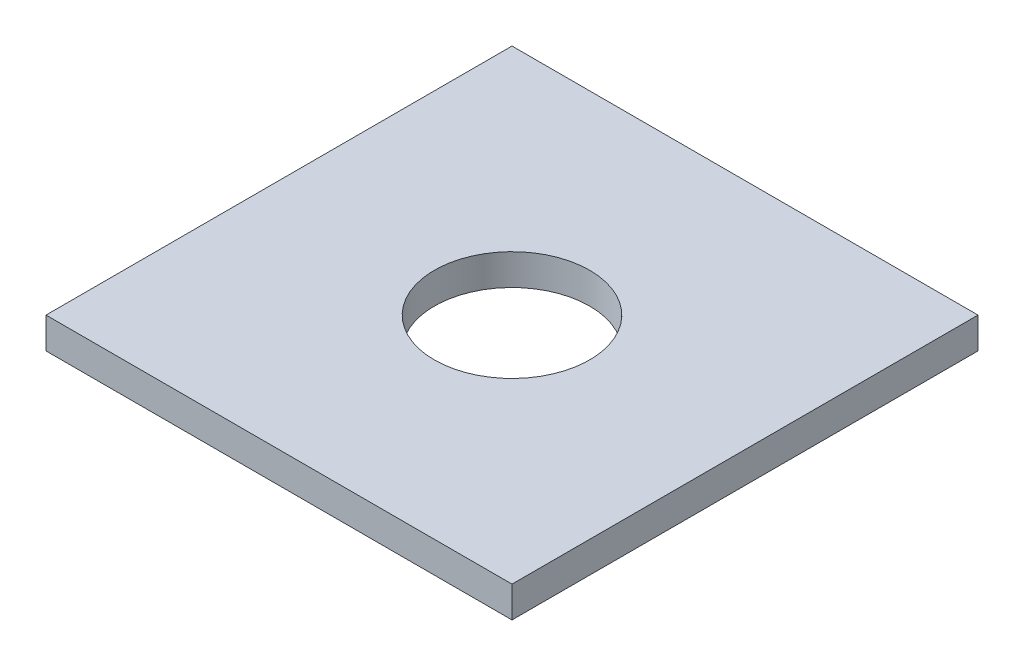
from build123d import *

# Parameters (mm, degrees)
SKETCH1_W          = 90
SKETCH1_H          = 6
BASE_EXTRUDE_DEPTH = 45
SKETCH2_R          = 15
CUT_EXTRUDE1_DEPTH = 64.921827258


with BuildPart() as part:
    # Sketch1 → Base-Extrude (new, symmetric)
    with BuildSketch(Plane.XY):
        with Locations((0, 3)):
            Rectangle(SKETCH1_W, SKETCH1_H)
    extrude(amount=BASE_EXTRUDE_DEPTH, both=True)

    # Sketch2 → Cut-Extrude1 (cut, through all)
    with BuildSketch(Plane(origin=(0, 6, 0), x_dir=(-1, 0, 0), z_dir=(0, 1, 0))):
        Circle(SKETCH2_R)
    extrude(amount=-CUT_EXTRUDE1_DEPTH, mode=Mode.SUBTRACT)


solid = part.part
